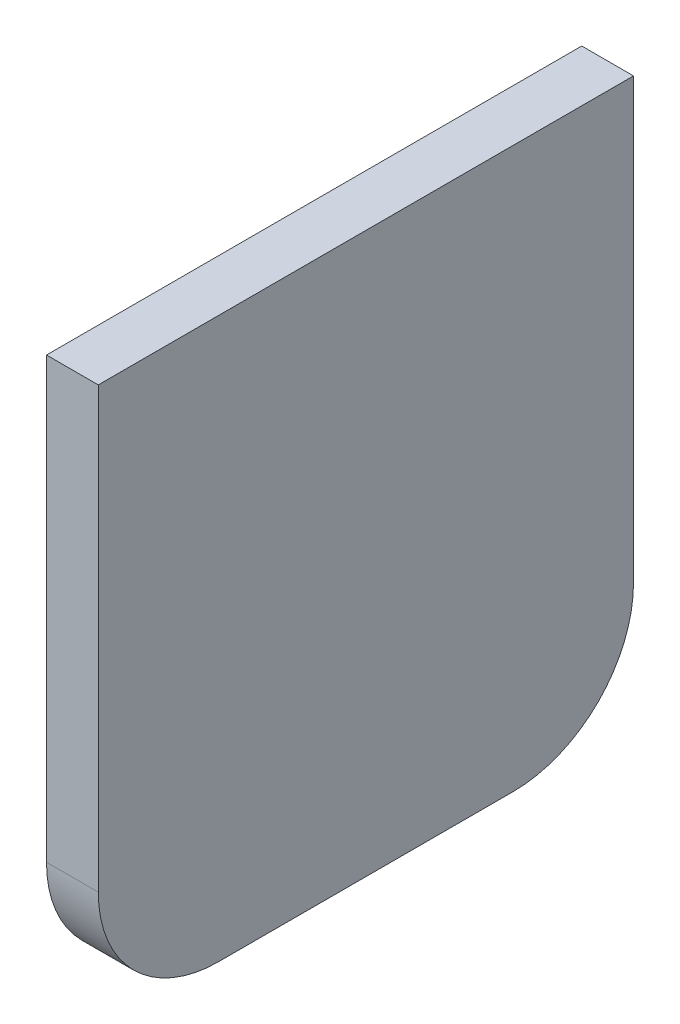
from build123d import *

# Parameters (mm, degrees)
SKETCH1_W           = 44.45
SKETCH1_H           = 46.482
BOSS_EXTRUDE1_DEPTH = 4.3
FILLET1_R           = 10


with BuildPart() as part:
    # Sketch1 → Boss-Extrude1 (new body)
    with BuildSketch(Plane(origin=(0, 0, 0), x_dir=(0, 0, -1), z_dir=(1, 0, 0))):
        Rectangle(SKETCH1_W, SKETCH1_H)
    extrude(amount=BOSS_EXTRUDE1_DEPTH)

    # Fillet1
    fillet1_edges = [part.edges().sort_by_distance(p)[0] for p in [
        (2.15, -23.241, -22.225),
        (2.15, -23.241, 22.225),
    ]]
    fillet(fillet1_edges, radius=FILLET1_R)


solid = part.part
